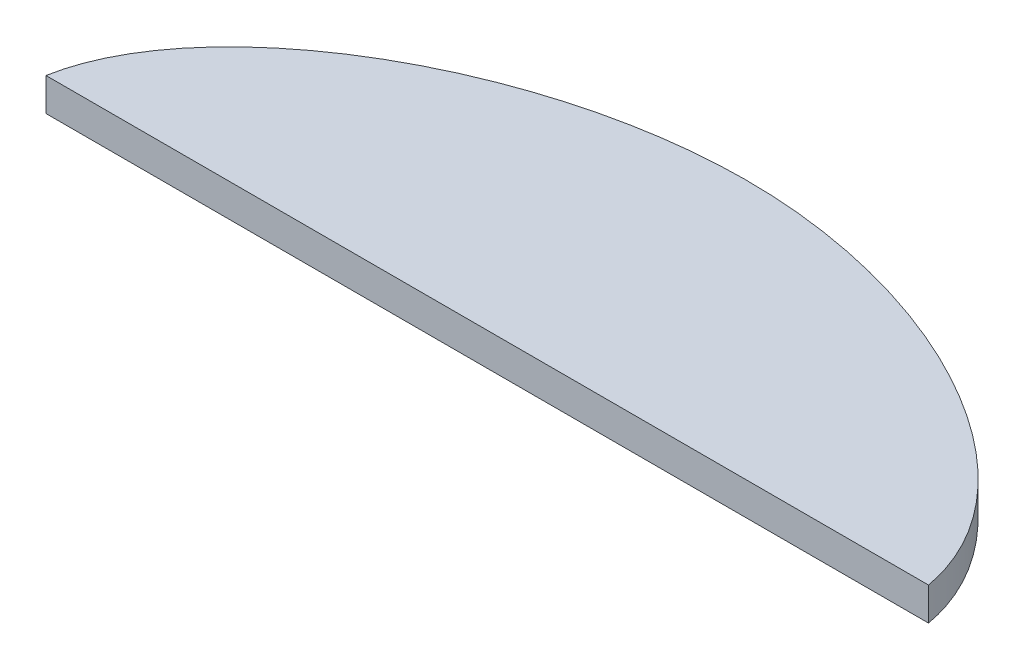
from build123d import *

# Parameters (mm, degrees)
BOSS_EXTRUDE1_DEPTH = 3.175


with BuildPart() as part:
    # Sketch1 → Boss-Extrude1 (new body)
    with BuildSketch(Plane(origin=(0, 0, 0), x_dir=(1, 0, 0), z_dir=(0, 1, 0))):
        with BuildLine():
            Line((0, 0), (85, 0))
            add(Edge.make_bspline(
                [(85, 0), (82.684690964, 13.13077004), (42.5, 36.86922996), (2.315309036, 13.13077004), (0, 0)],
                knots=[0.5, 0.5, 0.5, 0.5, 1, 1.5, 1.5, 1.5, 1.5], degree=3))
        make_face()
    extrude(amount=BOSS_EXTRUDE1_DEPTH)


solid = part.part
